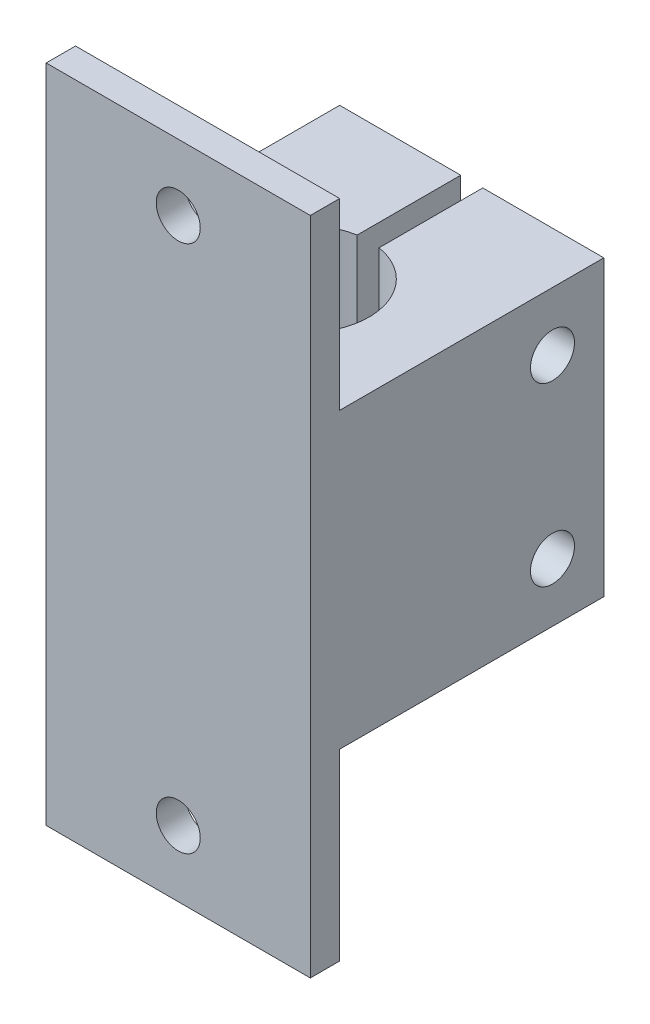
from build123d import *

# Parameters (mm, degrees)
SKETCH1_W           = 18
SKETCH1_H           = 18
BOSS_EXTRUDE1_DEPTH = 20
CUT_EXTRUDE1_DEPTH  = 29.372521918
SKETCH3_R           = 1.5
CUT_EXTRUDE2_DEPTH  = 33.372828112
SKETCH4_W           = 18
SKETCH4_H           = 45
BOSS_EXTRUDE2_DEPTH = 2
SKETCH5_R           = 1.5
CUT_EXTRUDE3_DEPTH  = 40.20777984


with BuildPart() as part:
    # Sketch1 → Boss-Extrude1 (new body)
    with BuildSketch(Plane(origin=(0, 0, 0), x_dir=(1, 0, 0), z_dir=(0, 1, 0))):
        with Locations((0, 9)):
            Rectangle(SKETCH1_W, SKETCH1_H)
    extrude(amount=BOSS_EXTRUDE1_DEPTH)

    # Sketch2 → Cut-Extrude1 (cut, through all)
    with BuildSketch(Plane(origin=(0, 20, 0), x_dir=(1, 0, 0), z_dir=(0, 1, 0))):
        with BuildLine():
            Line((0.75, 18), (-0.75, 18))
            Line((-0.75, 18), (-0.75, 10.937059837))
            ThreePointArc((-0.75, 10.937059837), (0, 2), (0.75, 10.937059837))
            Line((0.75, 10.937059837), (0.75, 18))
        make_face()
    extrude(amount=-CUT_EXTRUDE1_DEPTH, mode=Mode.SUBTRACT)

    # Sketch3 → Cut-Extrude2 (cut, through all)
    with BuildSketch(Plane(origin=(9, 0, 0), x_dir=(0, 0, -1), z_dir=(1, 0, 0))):
        with Locations((14.5, 16)):
            Circle(SKETCH3_R)
        with Locations((14.5, 4)):
            Circle(SKETCH3_R)
    extrude(amount=-CUT_EXTRUDE2_DEPTH, mode=Mode.SUBTRACT)

    # Sketch4 → Boss-Extrude2 (add)
    with BuildSketch(Plane.XY):
        with Locations((0, 10)):
            Rectangle(SKETCH4_W, SKETCH4_H)
    extrude(amount=BOSS_EXTRUDE2_DEPTH)

    # Sketch5 → Cut-Extrude3 (cut, through all)
    with BuildSketch(Plane.XY.offset(2)):
        with Locations((0, 28)):
            Circle(SKETCH5_R)
        with Locations((0, -8)):
            Circle(SKETCH5_R)
    extrude(amount=-CUT_EXTRUDE3_DEPTH, mode=Mode.SUBTRACT)


solid = part.part
